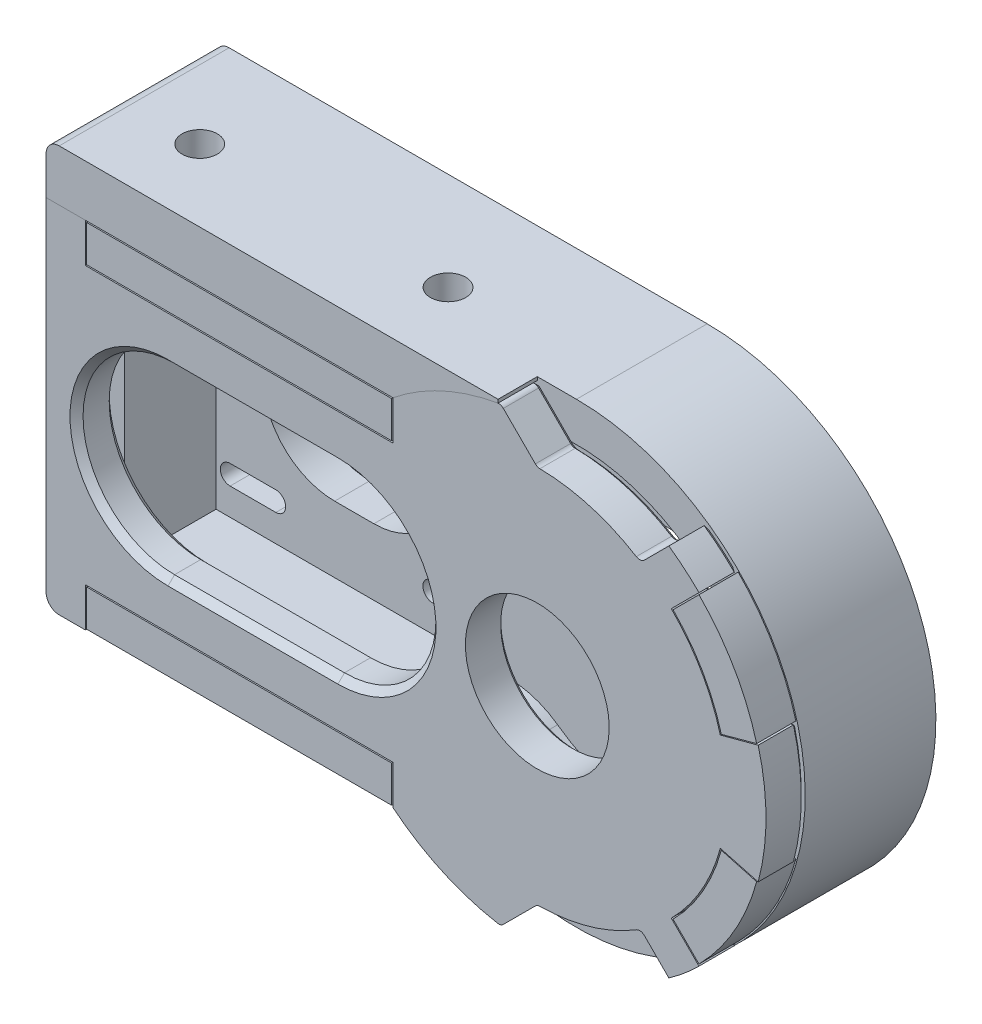
from build123d import *

# Parameters (mm, degrees)
SKETCH1_W            = 42.3
SKETCH1_H            = 42.3
SKETCH1_R            = 11
SKETCH1_R_2          = 1.5
SKETCH1_W_2          = 50
BOSS_EXTRUDE1_DEPTH  = 6
SKETCH3_R            = 11
BOSS_EXTRUDE2_DEPTH  = 6
BOSS_EXTRUDE3_DEPTH  = 20
BOSS_EXTRUDE4_DEPTH  = 20
CUT_EXTRUDE1_DEPTH   = 92.159201401
SKETCH5_R            = 11
BOSS_EXTRUDE6_DEPTH  = 6
SKETCH8_W            = 46.662050797
SKETCH8_H            = 5.6
BOSS_EXTRUDE13_DEPTH = 26
SKETCH9_R            = 1.25
CUT_EXTRUDE2_DEPTH   = 15
SKETCH10_R           = 1.25
CUT_EXTRUDE3_DEPTH   = 15
CHAMFER2_SIZE        = 0.6
CHAMFER3_SIZE        = 6
FILLET5_R            = 1
CHAMFER4_SIZE        = 0.6
CUT_EXTRUDE7_DEPTH   = 6
FILLET7_R            = 13
CHAMFER5_SIZE        = 1
BOSS_EXTRUDE14_START = -26
BOSS_EXTRUDE14_DEPTH = 26
CUT_EXTRUDE8_DEPTH   = 6
CUT_EXTRUDE9_DEPTH   = 4.5
SKETCH20_R           = 2.7
CUT_EXTRUDE10_DEPTH  = 104.52691679
FILLET8_R            = 2
FILLET9_R            = 2


with BuildPart() as part:
    # Sketch1 → Boss-Extrude1 (new body)
    # profile 1 of 2: a face of its own
    with BuildSketch(Plane.XY):
        Rectangle(SKETCH1_W, SKETCH1_H)
        Circle(SKETCH1_R, mode=Mode.SUBTRACT)
        with Locations((-15.5, -15.5)):
            Circle(SKETCH1_R_2, mode=Mode.SUBTRACT)
        with Locations((15.5, -15.5)):
            Circle(SKETCH1_R_2, mode=Mode.SUBTRACT)
        with Locations((15.5, 15.5)):
            Circle(SKETCH1_R_2, mode=Mode.SUBTRACT)
        with Locations((-15.5, 15.5)):
            Circle(SKETCH1_R_2, mode=Mode.SUBTRACT)
    # profile 2 of 2: a face of its own
    with BuildSketch(Plane.XY):
        with Locations((46.15, 0)):
            Rectangle(SKETCH1_W_2, SKETCH1_H)
        with Locations((48, 0)):
            Circle(SKETCH1_R, mode=Mode.SUBTRACT)
    extrude(amount=BOSS_EXTRUDE1_DEPTH)

    # Sketch3 → Boss-Extrude2 (add)
    with BuildSketch(Plane.XY):
        with BuildLine():
            ThreePointArc((77, 0), (59.523933146, 26.612007907), (28.158692079, 21.15))
            ThreePointArc((28.158692079, 21.15), (19, 0), (28.158692079, -21.15))
            ThreePointArc((28.158692079, -21.15), (59.523933146, -26.612007907), (77, 0))
        make_face()
        with Locations((48, 0)):
            Circle(SKETCH3_R, mode=Mode.SUBTRACT)
    extrude(amount=BOSS_EXTRUDE2_DEPTH)

    # Sketch3<3> → Boss-Extrude3 (add)
    with BuildSketch(Plane.XY):
        with BuildLine():
            ThreePointArc((83, 0), (59.15705072, 33.174089576), (20.11313033, 21.15))
            Line((20.11313033, 21.15), (28.158692079, 21.15))
            ThreePointArc((28.158692079, 21.15), (59.523933146, 26.612007907), (77, 0))
            ThreePointArc((77, 0), (59.523933146, -26.612007907), (28.158692079, -21.15))
            Line((28.158692079, -21.15), (20.11313033, -21.15))
            ThreePointArc((20.11313033, -21.15), (59.15705072, -33.174089576), (83, 0))
        make_face()
    extrude(amount=BOSS_EXTRUDE3_DEPTH)

    # Sketch1<3> → Boss-Extrude4 (add)
    with BuildSketch(Plane.XY):
        Polygon((28.15, 27.15), (21.15, 27.15), (-27.15, 27.15), (-27.15, -27.15), (21.15, -27.15), (28.15, -27.15), (28.15, -21.15), (21.15, -21.15), (-21.15, -21.15), (-21.15, 21.15), (21.15, 21.15), (28.15, 21.15), align=None)
    extrude(amount=BOSS_EXTRUDE4_DEPTH)

    # Sketch4 → Cut-Extrude1 (cut, through all)
    with BuildSketch(Plane.XY.offset(6)):
        with BuildLine():
            Line((-19, 17), (-12, 17))
            ThreePointArc((-12, 17), (-10.5, 15.5), (-12, 14))
            Line((-12, 14), (-19, 14))
            ThreePointArc((-19, 14), (-20.5, 15.5), (-19, 17))
        make_face()
        with BuildLine():
            Line((12, 17), (19, 17))
            ThreePointArc((19, 17), (20.5, 15.5), (19, 14))
            Line((19, 14), (12, 14))
            ThreePointArc((12, 14), (10.5, 15.5), (12, 17))
        make_face()
        with BuildLine():
            Line((12, -14), (19, -14))
            ThreePointArc((19, -14), (20.5, -15.5), (19, -17))
            Line((19, -17), (12, -17))
            ThreePointArc((12, -17), (10.5, -15.5), (12, -14))
        make_face()
        with BuildLine():
            Line((-12, -17), (-19, -17))
            ThreePointArc((-19, -17), (-20.5, -15.5), (-19, -14))
            Line((-19, -14), (-12, -14))
            ThreePointArc((-12, -14), (-10.5, -15.5), (-12, -17))
        make_face()
        with BuildLine():
            Line((-3, 11), (3, 11))
            ThreePointArc((3, 11), (14, 0), (3, -11))
            Line((3, -11), (-3, -11))
            ThreePointArc((-3, -11), (-14, 0), (-3, 11))
        make_face()
    extrude(amount=-CUT_EXTRUDE1_DEPTH, mode=Mode.SUBTRACT)

    # Sketch8 → Boss-Extrude13 (add)
    with BuildSketch(Plane(origin=(0, 0, 0), x_dir=(-1, 0, 0), z_dir=(0, 0, -1))):
        with Locations((-2.381025398, 24.15)):
            Rectangle(SKETCH8_W, SKETCH8_H)
        with Locations((-2.381025398, -24.15)):
            Rectangle(SKETCH8_W, SKETCH8_H)
        with BuildLine():
            ThreePointArc((-72.748330955, 24.465488242), (-78.149716201, 17.379143046), (-81.574598869, 9.153486263))
            Line((-81.574598869, 9.153486263), (-76.171789856, 7.680511462))
            ThreePointArc((-76.171789856, 7.680511462), (-73.306070382, 14.568555242), (-68.788455041, 20.505612329))
            Line((-68.788455041, 20.505612329), (-72.748330955, 24.465488242))
        make_face()
        with BuildLine():
            Line((-76.171789856, -7.680511462), (-81.574598869, -9.153486263))
            ThreePointArc((-81.574598869, -9.153486263), (-78.149716201, -17.379143046), (-72.748330955, -24.465488242))
            Line((-72.748330955, -24.465488242), (-68.788455041, -20.505612329))
            ThreePointArc((-68.788455041, -20.505612329), (-73.306070382, -14.568555242), (-76.171789856, -7.680511462))
        make_face()
    extrude(amount=-BOSS_EXTRUDE13_DEPTH)


with BuildPart() as body_2:
    # Sketch5 → Boss-Extrude6 (new body)
    with BuildSketch(Plane.XY.offset(20)):
        with BuildLine():
            Line((81.80740392, 9.058666579), (76.011848962, 7.505752308))
            ThreePointArc((76.011848962, 7.505752308), (73.11473671, 14.5), (68.506096654, 20.506096654))
            Line((68.506096654, 20.506096654), (72.748737342, 24.748737342))
            ThreePointArc((72.748737342, 24.748737342), (70.527760652, 26.786190472), (68.139729993, 28.625011368))
            Line((68.139729993, 28.625011368), (63.819761961, 24.305043335))
            ThreePointArc((63.819761961, 24.305043335), (56.250870963, 27.801495074), (48, 29))
            Line((48, 29), (48, 35))
            ThreePointArc((48, 35), (36.27929183, 32.979160086), (25.912050797, 27.15))
            Line((25.912050797, 27.15), (25.912050797, 21.15))
            Line((25.912050797, 21.15), (-21.15, 21.15))
            Line((-21.15, 21.15), (-21.15, 27.15))
            Line((-21.15, 27.15), (-27.15, 27.15))
            Line((-27.15, 27.15), (-27.15, -27.15))
            Line((-27.15, -27.15), (-21.15, -27.15))
            Line((-21.15, -27.15), (-21.15, -21.15))
            Line((-21.15, -21.15), (25.912050797, -21.15))
            Line((25.912050797, -21.15), (25.912050797, -27.15))
            ThreePointArc((25.912050797, -27.15), (36.27929183, -32.979160086), (48, -35))
            Line((48, -35), (48, -29))
            ThreePointArc((48, -29), (56.250870963, -27.801495074), (63.819761961, -24.305043335))
            Line((63.819761961, -24.305043335), (68.139729993, -28.625011368))
            ThreePointArc((68.139729993, -28.625011368), (70.527760652, -26.786190472), (72.748737342, -24.748737342))
            Line((72.748737342, -24.748737342), (68.506096654, -20.506096654))
            ThreePointArc((68.506096654, -20.506096654), (73.11473671, -14.5), (76.011848962, -7.505752308))
            Line((76.011848962, -7.505752308), (81.80740392, -9.058666579))
            ThreePointArc((81.80740392, -9.058666579), (83, 0), (81.80740392, 9.058666579))
        make_face()
        with Locations((48, 0)):
            Circle(SKETCH5_R, mode=Mode.SUBTRACT)
    extrude(amount=BOSS_EXTRUDE6_DEPTH)


with BuildPart() as cut_extrude2_tool:
    # Sketch9 → Cut-Extrude2 (new body)
    with BuildSketch(Plane(origin=(19.757359313, 19.757359313, 0), x_dir=(0, 0, 1), z_dir=(-0.7071067811865476, -0.7071067811865476, 0))):
        with Locations(Location((23, -65.368326106, 0), (0, 0, 270))):
            Circle(SKETCH9_R)
    cut_extrude2 = extrude(amount=-CUT_EXTRUDE2_DEPTH)


with BuildPart() as part_1:
    add(part.part)

    # Cut-Extrude2: cut by cut_extrude2_tool
    add(cut_extrude2_tool.part, mode=Mode.SUBTRACT)


with BuildPart() as body_2_1:
    add(body_2.part)

    # Cut-Extrude2: cut by cut_extrude2_tool
    add(cut_extrude2_tool.part, mode=Mode.SUBTRACT)


with BuildPart() as mirror1_tool:
    # Mirror1: Cut-Extrude2 across plane
    add(cut_extrude2.mirror(Plane.ZX))


with BuildPart() as part_2:
    add(part_1.part)

    # Mirror1: cut by mirror1_tool
    add(mirror1_tool.part, mode=Mode.SUBTRACT)


with BuildPart() as body_2_2:
    add(body_2_1.part)

    # Mirror1: cut by mirror1_tool
    add(mirror1_tool.part, mode=Mode.SUBTRACT)


with BuildPart() as cut_extrude3_tool:
    # Sketch10 → Cut-Extrude3 (new body)
    with BuildSketch(Plane.ZY.offset(27.15)):
        with Locations((23, 24.15)):
            Circle(SKETCH10_R)
        with Locations((23, -24.15)):
            Circle(SKETCH10_R)
    extrude(amount=-CUT_EXTRUDE3_DEPTH)


with BuildPart() as part_3:
    add(part_2.part)

    # Cut-Extrude3: cut by cut_extrude3_tool
    add(cut_extrude3_tool.part, mode=Mode.SUBTRACT)

    # Chamfer2
    chamfer2_edges = [part_3.edges().sort_by_distance(p)[0] for p in [
        (37, 0, 0),
        (-15.5, 14, 0),
        (-15.5, 17, 0),
        (0, -11, 0),
        (0, 11, 0),
        (-15.5, -14, 0),
        (-15.5, -17, 0),
        (15.5, -17, 0),
        (15.5, -14, 0),
        (15.5, 14, 0),
        (15.5, 17, 0),
        (10.5, 15.5, 0),
        (20.5, 15.5, 0),
        (10.5, -15.5, 0),
        (20.5, -15.5, 0),
        (-10.5, -15.5, 0),
        (-20.5, -15.5, 0),
        (-14, 0, 0),
        (14, 0, 0),
        (-20.5, 15.5, 0),
        (-10.5, 15.5, 0),
    ]]
    chamfer(chamfer2_edges, length=CHAMFER2_SIZE)

    # Fillet7
    fillet7_edges = [part_3.edges().sort_by_distance(p)[0] for p in [
        (28.158692079, -21.15, 13),
        (28.158692079, 21.15, 13),
    ]]
    fillet(fillet7_edges, radius=FILLET7_R)

    # Sketch17 → Boss-Extrude14 (add)
    with BuildSketch(Plane(origin=(0, 0, 0), x_dir=(-1, 0, 0), z_dir=(0, 0, -1)).offset(BOSS_EXTRUDE14_START)):
        with BuildLine():
            Line((27.15, 27.15), (-25.912050797, 27.15))
            ThreePointArc((-25.912050797, 27.15), (-36.27929183, 32.979160086), (-48, 35))
            Line((-48, 35), (27.15, 35))
            Line((27.15, 35), (27.15, 27.15))
        make_face()
    extrude(amount=BOSS_EXTRUDE14_DEPTH)

    # Sketch18 → Cut-Extrude8 (cut)
    with BuildSketch(Plane.XY.offset(26)):
        with BuildLine():
            Line((42, 35), (42, 34.481879299))
            ThreePointArc((42, 34.481879299), (44.988835397, 34.870229247), (48, 35))
            Line((48, 35), (42, 35))
        make_face()
    extrude(amount=-CUT_EXTRUDE8_DEPTH, mode=Mode.SUBTRACT)

    # Sketch19 → Cut-Extrude9 (cut)
    with BuildSketch(Plane.XZ.offset(-21.15)):
        Polygon((-11.878718708, 19.8), (-17.421281292, 19.8), (-20.192562584, 15), (-17.421281292, 10.2), (-11.878718708, 10.2), (-9.107437416, 15), align=None)
        Polygon((26.121281292, 19.8), (20.578718708, 19.8), (17.807437416, 15), (20.578718708, 10.2), (26.121281292, 10.2), (28.892562584, 15), align=None)
    extrude(amount=-CUT_EXTRUDE9_DEPTH, mode=Mode.SUBTRACT)

    # Sketch20 → Cut-Extrude10 (cut, through all)
    with BuildSketch(Plane.XZ.offset(-21.15)):
        with Locations(Location((-14.65, 15, 0), (0, 0, 270))):
            Circle(SKETCH20_R)
        with Locations(Location((23.35, 15, 0), (0, 0, 270))):
            Circle(SKETCH20_R)
    extrude(amount=-CUT_EXTRUDE10_DEPTH, mode=Mode.SUBTRACT)

    # Fillet8
    fillet8_edges = [part_3.edges().sort_by_distance(p)[0] for p in [
        (25.912050797, -27.15, 10),
        (-27.15, -27.15, 10),
        (-27.15, 35, 13),
    ]]
    fillet(fillet8_edges, radius=FILLET8_R)


with BuildPart() as body_2_3:
    add(body_2_2.part)

    # Cut-Extrude3: cut by cut_extrude3_tool
    add(cut_extrude3_tool.part, mode=Mode.SUBTRACT)

    # Chamfer3
    # the kernel refuses this chamfer: 6 mm, written as the material it takes off along each edge
    with BuildSketch(Plane(origin=(48, -35, 4.569902072), x_dir=(-0.9968247526172548, 0.07962670763976631, 0), z_dir=(0, 0, 1))) as chamfer3_piece_1_section:
        with BuildLine():
            Line((5.573869535, 0), (CHAMFER3_SIZE * 0.0796267076398, -CHAMFER3_SIZE * 0.996824752617))
            Line((CHAMFER3_SIZE * 0.0796267076398, -CHAMFER3_SIZE * 0.996824752617), (0, 0))
            ThreePointArc((0, 0), (2.864805448, 0.111047032), (5.573869535, 0))
        make_face()
    chamfer3_piece_1 = extrude(amount=36.860195856, mode=Mode.PRIVATE)
    chamfer3_piece_1 = chamfer3_piece_1 - Plane(origin=(48, 0, 4.569902072), x_dir=(0, -1, 0), z_dir=(0, 0, -1)) * Cylinder(29, 98, mode=Mode.PRIVATE)
    add(chamfer3_piece_1, mode=Mode.SUBTRACT)
    with BuildSketch(Plane(origin=(48, 35, 4.569902072), x_dir=(0, -1, 0), z_dir=(0, 0, 1))) as chamfer3_piece_2_section:
        with BuildLine():
            Line((CHAMFER3_SIZE, 0), (0.44382888, -5.55617112))
            ThreePointArc((0.44382888, -5.55617112), (0.117420596, -2.864551292), (0, 0))
            Line((0, 0), (CHAMFER3_SIZE, 0))
        make_face()
    chamfer3_piece_2 = extrude(amount=36.860195856, mode=Mode.PRIVATE)
    chamfer3_piece_2 = chamfer3_piece_2 - Plane(origin=(48, 0, 4.569902072), x_dir=(0.5455090331247942, 0.8381049425813287, 0), z_dir=(0, 0, -1)) * Cylinder(29, 98, mode=Mode.PRIVATE)
    add(chamfer3_piece_2, mode=Mode.SUBTRACT)

    # Fillet5
    fillet5_edges = [body_2_3.edges().sort_by_distance(p)[0] for p in [
        (42.44382888, 34.55617112, 23),
        (42.44382888, -34.55617112, 23),
        (63.819761961, 24.305043335, 23),
        (63.819761961, -24.305043335, 23),
        (48, -29, 23),
        (48, 29, 23),
    ]]
    fillet(fillet5_edges, radius=FILLET5_R)

    # Chamfer4
    chamfer4_edges = [body_2_3.edges().sort_by_distance(p)[0] for p in [
        (56.067227778, 27.855337657, 20),
        (66.262370325, 26.7476517, 20),
        (33.452140026, 31.833312271, 20),
        (45.259241588, 31.740758412, 20),
        (66.262370325, -26.7476517, 20),
        (56.067227778, -27.855337657, 20),
        (45.259241588, -31.740758412, 20),
        (42.40215256, -34.438109356, 20),
        (42.40215256, 34.438109356, 20),
        (63.795384067, 24.584323587, 20),
        (48.02801638, 29.075903364, 20),
        (63.795384067, -24.584323587, 20),
        (48.02801638, -29.075903364, 20),
        (70.527760652, 26.786190472, 20),
        (70.627416998, 22.627416998, 20),
        (73.11473671, 14.5, 20),
        (78.909626441, 8.282209443, 20),
        (83, 0, 20),
        (78.909626441, -8.282209443, 20),
        (73.11473671, -14.5, 20),
        (70.627416998, -22.627416998, 20),
        (70.527760652, -26.786190472, 20),
        (33.452140026, -31.833312271, 20),
        (25.912050797, -24.15, 20),
        (2.381025398, -21.15, 20),
        (-21.15, -24.15, 20),
        (-24.15, -27.15, 20),
        (-27.15, 0, 20),
        (-24.15, 27.15, 20),
        (-21.15, 24.15, 20),
        (2.381025398, 21.15, 20),
        (25.912050797, 24.15, 20),
        (37, 0, 20),
        (37, 0, 20),
    ]]
    chamfer(chamfer4_edges, length=CHAMFER4_SIZE)

    # Sketch15 → Cut-Extrude7 (cut)
    with BuildSketch(Plane.XY.offset(26)):
        with BuildLine():
            Line((-8.5, 14), (17.5, 14))
            ThreePointArc((17.5, 14), (31.5, 0), (17.5, -14))
            Line((17.5, -14), (-8.5, -14))
            ThreePointArc((-8.5, -14), (-22.5, 0), (-8.5, 14))
        make_face()
    extrude(amount=-CUT_EXTRUDE7_DEPTH, mode=Mode.SUBTRACT)

    # Chamfer5
    chamfer5_edges = [body_2_3.edges().sort_by_distance(p)[0] for p in [
        (-22.5, 0, 26),
        (4.5, -14, 26),
        (31.5, 0, 26),
        (4.5, 14, 26),
        (4.5, -14, 20),
        (-22.5, 0, 20),
        (4.5, 14, 20),
        (31.5, 0, 20),
    ]]
    chamfer(chamfer5_edges, length=CHAMFER5_SIZE)

    # Fillet9
    # the kernel refuses this fillet: 2 mm, written as the material it takes off along each edge
    with BuildSketch(Plane(origin=(-27.15, -27.15, 15.6), x_dir=(1, 0, 0), z_dir=(0, 0, 1))) as fillet9_piece_1:
        with BuildLine():
            CenterArc((FILLET9_R, FILLET9_R), FILLET9_R, 180, 90)
            Line((0, FILLET9_R), (0, 0))
            Line((0, 0), (FILLET9_R, 0))
        make_face()
    extrude(amount=15.4, mode=Mode.SUBTRACT)


solid = Compound([part_3.part, body_2_3.part])
